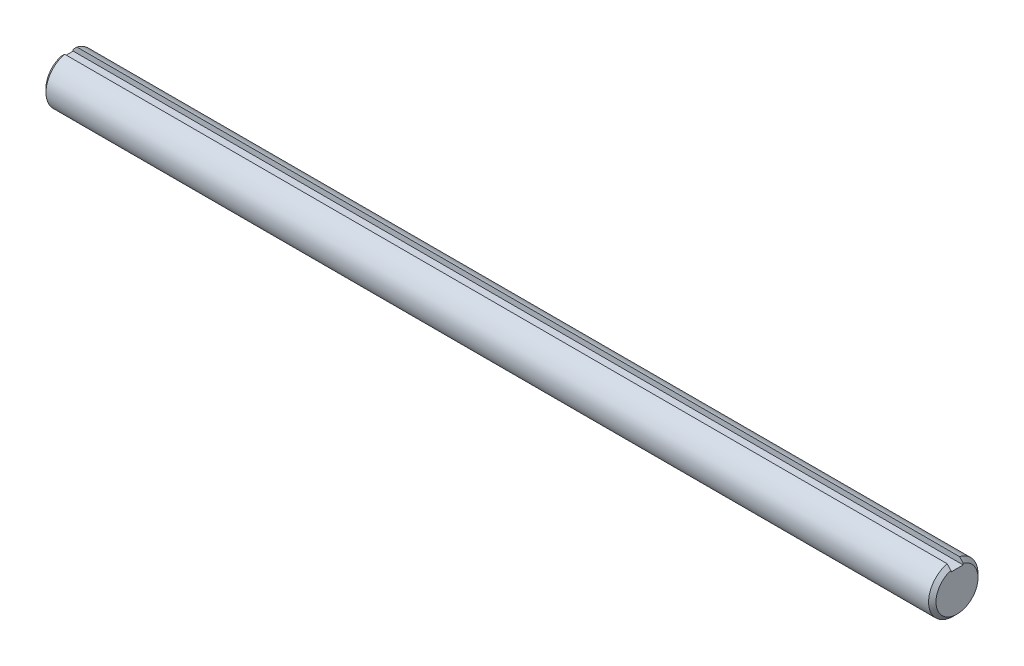
from build123d import *

# Parameters (mm, degrees)
SKETCH1_R           = 12.7
EXTRUDE1_DEPTH      = 228.6
CHAMFER1_SIZE       = 1.905
EXTRUDE2_DEPTH      = 230.304470083
EXTRUDE2_DEPTH_BACK = 230.304470083
SKETCH3_W           = 6.35
SKETCH3_H           = 3.175


with BuildPart() as part:
    # Sketch1 → Extrude1 (new, symmetric)
    with BuildSketch(Plane(origin=(0, 0, 0), x_dir=(0, 0, -1), z_dir=(1, 0, 0))):
        Circle(SKETCH1_R)
    extrude(amount=EXTRUDE1_DEPTH, both=True)

    # Chamfer1
    chamfer1_edges = [part.edges().sort_by_distance(p)[0] for p in [
        (-228.6, 0, 12.7),
        (228.6, 0, 12.7),
    ]]
    chamfer(chamfer1_edges, length=CHAMFER1_SIZE)

    # Sketch3 → Extrude2 (cut, two sides: drawn at the far end of the back side and taken through both)
    with BuildSketch(Plane(origin=(0, 0, 0), x_dir=(0, 0, -1), z_dir=(1, 0, 0)).offset(-EXTRUDE2_DEPTH_BACK)):
        with Locations((0, 11.1125)):
            Rectangle(SKETCH3_W, SKETCH3_H)
    extrude(amount=EXTRUDE2_DEPTH + EXTRUDE2_DEPTH_BACK, mode=Mode.SUBTRACT)


solid = part.part
